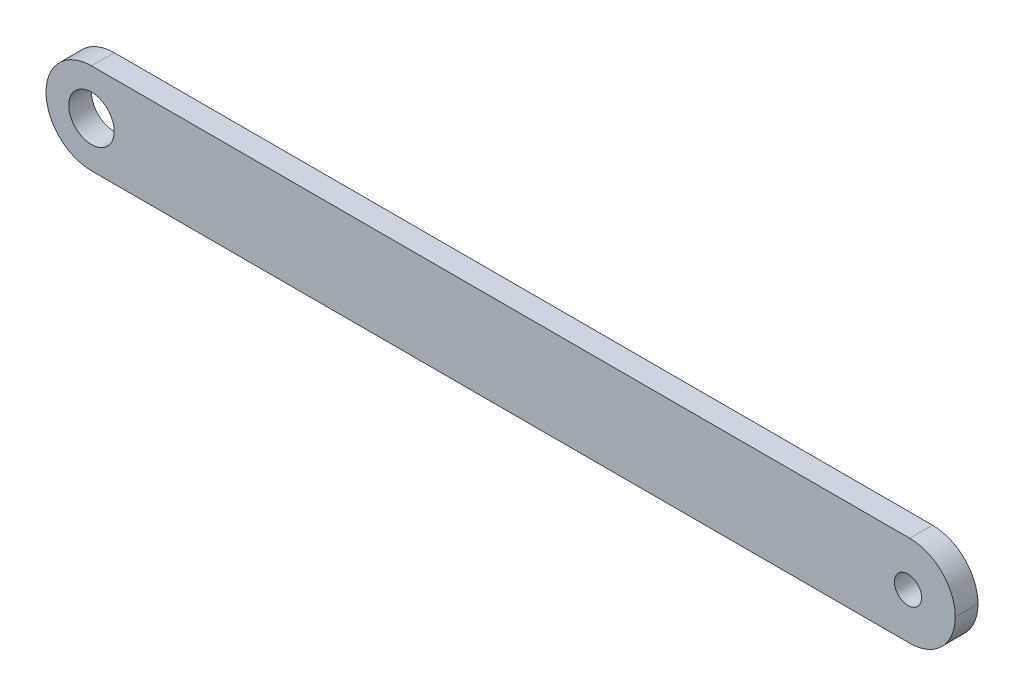
from build123d import *

# Parameters (mm, degrees)
SKETCH1_W           = 127
SKETCH1_H           = 12.7
BOSS_EXTRUDE1_DEPTH = 3.175
FILLET1_R           = 6.35
SKETCH2_R           = 3.175
SKETCH2_R_2         = 1.905
CUT_EXTRUDE1_DEPTH  = 3.175
FILLET2_R           = 6.35


with BuildPart() as part:
    # Sketch1 → Boss-Extrude1 (new body)
    with BuildSketch(Plane.XY):
        with Locations((63.5, 6.35)):
            Rectangle(SKETCH1_W, SKETCH1_H)
    extrude(amount=BOSS_EXTRUDE1_DEPTH)

    # Fillet1
    fillet1_edges = [part.edges().sort_by_distance(p)[0] for p in [
        (0, 0, 1.5875),
        (0, 12.7, 1.5875),
    ]]
    fillet(fillet1_edges, radius=FILLET1_R - 0.0001)  # a hair under: the kernel refuses the full size

    # Sketch2 → Cut-Extrude1 (cut)
    with BuildSketch(Plane.XY.offset(3.175)):
        with Locations((6.35, 6.35)):
            Circle(SKETCH2_R)
        with Locations((120.396, 6.35)):
            Circle(SKETCH2_R_2)
    extrude(amount=-CUT_EXTRUDE1_DEPTH, mode=Mode.SUBTRACT)

    # Fillet2
    fillet2_edges = [part.edges().sort_by_distance(p)[0] for p in [
        (127, 0, 1.5875),
        (127, 12.7, 1.5875),
    ]]
    fillet(fillet2_edges, radius=FILLET2_R - 0.0001)  # a hair under: the kernel refuses the full size


solid = part.part
